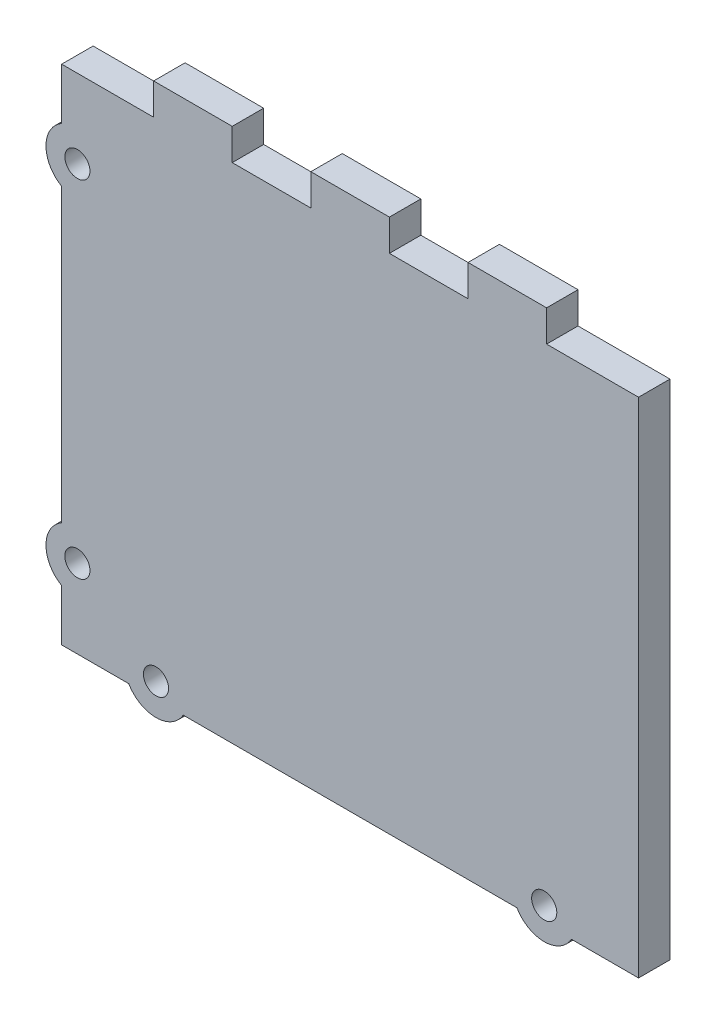
from build123d import *

# Parameters (mm, degrees)
SKETCH1_W             = 73.400000004
SKETCH1_H             = 64
BOSS_EXTRUDE1_DEPTH   = 4
BOSS_EXTRUDE2_DEPTH   = 4
SKETCH2_3_R           = 1.6
CUT_EXTRUDE1_DEPTH    = 4
BOSS_EXTRUDE3_DEPTH   = 4
SKETCH2_5_R           = 1.6
CUT_EXTRUDE2_DEPTH    = 4
SKETCH3_W             = 10
SKETCH3_H             = 4.5
BOSS_EXTRUDE4_DEPTH   = 4
BOSS_EXTRUDE4_2_DEPTH = 4
BOSS_EXTRUDE4_3_DEPTH = 4


with BuildPart() as part:
    # Sketch1 → Boss-Extrude1 (new body)
    with BuildSketch(Plane.XY):
        with Locations((0.200000002, -2.2)):
            Rectangle(SKETCH1_W, SKETCH1_H)
    extrude(amount=BOSS_EXTRUDE1_DEPTH)

    # Sketch2 → Boss-Extrude2 (add)
    with BuildSketch(Plane.XY.offset(4)):
        with BuildLine():
            ThreePointArc((21.433466103, -34.2), (24.9, -36.204218764), (28.366533897, -34.2))
            Line((28.366533897, -34.2), (21.433466103, -34.2))
        make_face()
    boss_extrude2 = extrude(amount=-BOSS_EXTRUDE2_DEPTH)

    # Sketch2<3> → Cut-Extrude1 (cut)
    with BuildSketch(Plane.XY.offset(4)):
        with Locations((24.9, -32.204218764)):
            Circle(SKETCH2_3_R)
    cut_extrude1 = extrude(amount=-CUT_EXTRUDE1_DEPTH, mode=Mode.SUBTRACT)

    # Mirror1: Boss-Extrude2, Cut-Extrude1 across plane
    add(boss_extrude2.mirror(Plane(origin=(0.200000002, 0, 0), x_dir=(0, 0, 1), z_dir=(1, 0, 0))))
    add(cut_extrude1.mirror(Plane(origin=(0.200000002, 0, 0), x_dir=(0, 0, 1), z_dir=(1, 0, 0))), mode=Mode.SUBTRACT)

    # Sketch2<4> → Boss-Extrude3 (add)
    with BuildSketch(Plane.XY.offset(4)):
        with BuildLine():
            ThreePointArc((-36.5, 23.264101615), (-38.5, 19.8), (-36.5, 16.335898385))
            Line((-36.5, 16.335898385), (-36.5, 23.264101615))
        make_face()
    boss_extrude3 = extrude(amount=-BOSS_EXTRUDE3_DEPTH)

    # Sketch2<5> → Cut-Extrude2 (cut)
    with BuildSketch(Plane.XY.offset(4)):
        with Locations((-34.5, 19.8)):
            Circle(SKETCH2_5_R)
    cut_extrude2 = extrude(amount=-CUT_EXTRUDE2_DEPTH, mode=Mode.SUBTRACT)

    # Mirror3: Boss-Extrude3, Cut-Extrude2 across plane
    add(boss_extrude3.mirror(Plane(origin=(0, -2.2, 0), x_dir=(0, 0, 1), z_dir=(0, -1, 0))))
    add(cut_extrude2.mirror(Plane(origin=(0, -2.2, 0), x_dir=(0, 0, 1), z_dir=(0, -1, 0))), mode=Mode.SUBTRACT)


with BuildPart() as body_2:
    # Sketch3 → Boss-Extrude4 (new body)
    with BuildSketch(Plane(origin=(0, 0, 0), x_dir=(-1, 0, 0), z_dir=(0, 0, -1))):
        with Locations((-20.200000004, 31.55)):
            Rectangle(SKETCH3_W, SKETCH3_H)
    extrude(amount=-BOSS_EXTRUDE4_DEPTH)


with BuildPart() as body_3:
    # Sketch3 → Boss-Extrude4 2 (new body)
    with BuildSketch(Plane(origin=(0, 0, 0), x_dir=(-1, 0, 0), z_dir=(0, 0, -1))):
        with Locations((-0.200000004, 31.55)):
            Rectangle(SKETCH3_W, SKETCH3_H)
    extrude(amount=-BOSS_EXTRUDE4_2_DEPTH)


with BuildPart() as body_4:
    # Sketch3 → Boss-Extrude4 3 (new body)
    with BuildSketch(Plane(origin=(0, 0, 0), x_dir=(-1, 0, 0), z_dir=(0, 0, -1))):
        with Locations((19.799999996, 31.55)):
            Rectangle(SKETCH3_W, SKETCH3_H)
    extrude(amount=-BOSS_EXTRUDE4_3_DEPTH)


with BuildPart() as body_2_1:
    add(body_2.part)

    # Combine1: union part, body 3, body 4
    add(part.part)
    add(body_3.part)
    add(body_4.part)


solid = body_2_1.part
